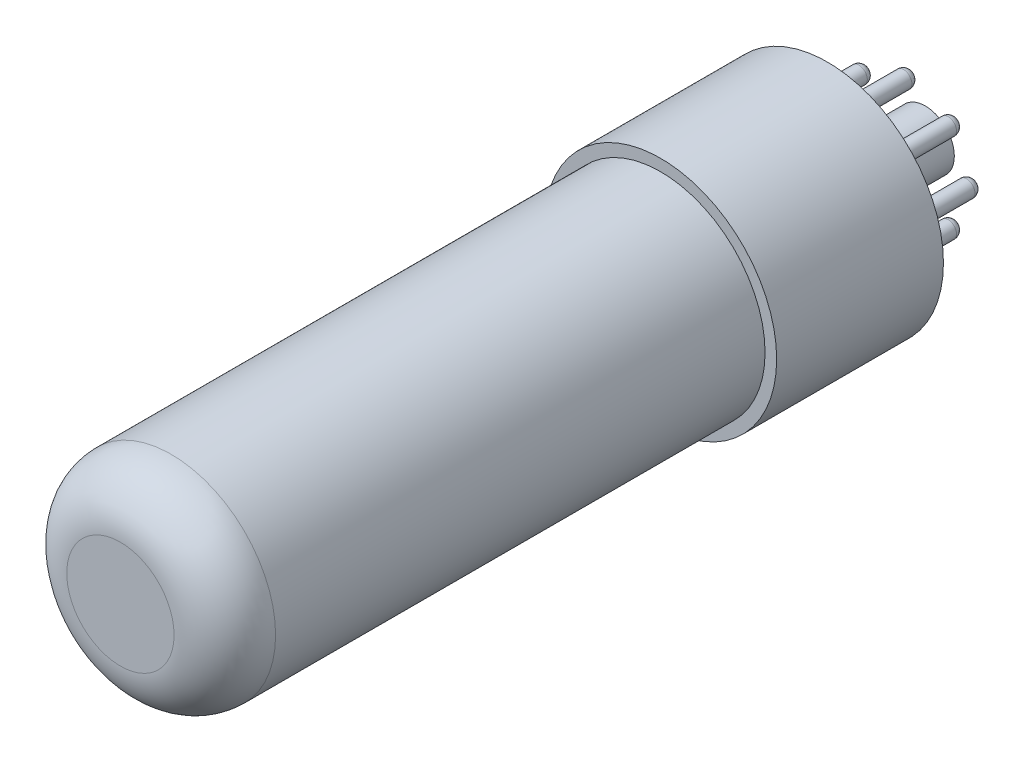
from build123d import *

# Parameters (mm, degrees)
SKETCH1_R                = 16
BASE_EXTRUDE_DEPTH       = 23
SKETCH2_R                = 14.4
SKETCH2_R_2              = 14.08
BOSS_EXTRUDE_THIN1_DEPTH = 69
SKETCH4_R                = 14.4
BOSS_EXTRUDE2_DEPTH      = 5.5
FILLET3_R                = 7
SKETCH5_R                = 4
BOSS_EXTRUDE3_DEPTH      = 13.5
SKETCH6_R                = 1.15
BOSS_EXTRUDE4_DEPTH      = 11.5
FILLET4_R                = 1
CIRPATTERN1_COUNT        = 8
FILLET4_OF_CIRPATTERN1_R = 1
BOSS_EXTRUDE5_DEPTH      = 0.3
EXTRUDE_THIN1_DEPTH      = 39
BOSS_EXTRUDE7_DEPTH      = 0.3
SKETCH15_W               = 2.2
SKETCH15_H               = 6
CUT_EXTRUDE14_DEPTH      = 18.3
SKETCH17_W               = 1.816140058
SKETCH17_H               = 1.29035869
CUT_EXTRUDE15_DEPTH      = 2.3
BOSS_EXTRUDE8_DEPTH      = 22.3
BOSS_EXTRUDE8_DEPTH_BACK = 19.3
BOSS_EXTRUDE9_DEPTH      = 37.3
BOSS_EXTRUDE9_DEPTH_BACK = 30.3
SKETCH18_3_R             = 0.5


# Read off the part's stored shape, not the designer's step: Extrude-Thin1
with BuildPart() as part:
    # Sketch1 → Base-Extrude (new body)
    with BuildSketch(Plane.XY):
        Circle(SKETCH1_R)
    extrude(amount=BASE_EXTRUDE_DEPTH)

    # Sketch2 → Boss-Extrude-Thin1 (add)
    with BuildSketch(Plane.XY.offset(23)):
        Circle(SKETCH2_R)
        Circle(SKETCH2_R_2, mode=Mode.SUBTRACT)
    extrude(amount=BOSS_EXTRUDE_THIN1_DEPTH)

    # Sketch4 → Boss-Extrude2 (add)
    with BuildSketch(Plane.XY.offset(92)):
        Circle(SKETCH4_R)
    extrude(amount=BOSS_EXTRUDE2_DEPTH)

    # Fillet3
    fillet3_edges = [part.edges().sort_by_distance(p)[0] for p in [
        (-14.4, 0, 97.5),
    ]]
    fillet(fillet3_edges, radius=FILLET3_R)

    # Sketch5 → Boss-Extrude3 (add)
    with BuildSketch(Plane(origin=(0, 0, 0), x_dir=(-1, 0, 0), z_dir=(0, 0, -1))):
        with Locations(Location((0, 0, 0), (0, 0, 180))):
            Circle(SKETCH5_R)
    extrude(amount=BOSS_EXTRUDE3_DEPTH)

    # Sketch6 → Boss-Extrude4 (add)
    with BuildSketch(Plane(origin=(0, 0, 0), x_dir=(-1, 0, 0), z_dir=(0, 0, -1))):
        with Locations(Location((8.7, 0, 0), (0, 0, 180))):
            Circle(SKETCH6_R)
    boss_extrude4 = extrude(amount=BOSS_EXTRUDE4_DEPTH)

    # Fillet4
    fillet4_edges = [part.edges().sort_by_distance(p)[0] for p in [
        (-9.85, 0, -11.5),
    ]]
    fillet(fillet4_edges, radius=FILLET4_R)

    # CirPattern1: Boss-Extrude4 ×8 about axis
    cirpattern1_axis = Axis((0, 0, 0), (0, 0, 1))
    for i in range(1, CIRPATTERN1_COUNT):
        add(boss_extrude4.rotate(cirpattern1_axis, i * 360 / CIRPATTERN1_COUNT))

    # Fillet4 of CirPattern1
    fillet4_of_cirpattern1_edges = [part.edges().sort_by_distance(p)[0] for p in [
        (-6.965001795, -6.965001795, -11.5),
        (0, -9.85, -11.5),
        (6.965001795, -6.965001795, -11.5),
        (9.85, 0, -11.5),
        (6.965001795, 6.965001795, -11.5),
        (0, 9.85, -11.5),
        (-6.965001795, 6.965001795, -11.5),
    ]]
    fillet(fillet4_of_cirpattern1_edges, radius=FILLET4_OF_CIRPATTERN1_R)



with BuildPart() as body_2:
    # Sketch7 → Boss-Extrude5 (new body)
    with BuildSketch(Plane.XY.offset(32)):
        Polygon((13.025686963, 4.711613485), (8.92476907, 10.593220452), (2.432466511, 13.636382554), (-4.711613485, 13.025686963), (-10.593220452, 8.92476907), (-13.636382554, 2.432466511), (-13.025686963, -4.711613485), (-8.92476907, -10.593220452), (-2.432466511, -13.636382554), (4.711613485, -13.025686963), (10.593220452, -8.92476907), (13.636382554, -2.432466511), align=None)
    extrude(amount=BOSS_EXTRUDE5_DEPTH)

    # Extrude-Thin1 outline → Extrude-Thin1 (add)
    with BuildSketch(Plane.XY.offset(32.3)):
        with BuildLine():
            ThreePointArc((8.807656387, 4.24917571), (8.655841302, 4.778875956), (8.246491686, 5.147743226))
            Line((8.246491686, 5.147743226), (5.750963675, 6.366489463))
            ThreePointArc((5.750963675, 6.366489463), (5.341614059, 6.735356733), (5.189798974, 7.265056979))
            Line((5.189798974, 7.265056979), (5.189798974, 7.807551147))
            ThreePointArc((5.189798974, 7.807551147), (4.896905756, 8.514657929), (4.189798974, 8.807551147))
            Line((4.189798974, 8.807551147), (0.318510646, 8.807551147))
            Line((0.318510646, 8.807551147), (0.318510646, 12.416922504))
            Line((0.318510646, 12.416922504), (-0.318510646, 12.416922504))
            Line((-0.318510646, 12.416922504), (-0.318510646, 8.807551147))
            Line((-0.318510646, 8.807551147), (-4.189798974, 8.807551147))
            ThreePointArc((-4.189798974, 8.807551147), (-4.896905756, 8.514657929), (-5.189798974, 7.807551147))
            Line((-5.189798974, 7.807551147), (-5.189798974, 7.265056979))
            ThreePointArc((-5.189798974, 7.265056979), (-5.341614059, 6.735356733), (-5.750963675, 6.366489463))
            Line((-5.750963675, 6.366489463), (-8.246491686, 5.147743226))
            ThreePointArc((-8.246491686, 5.147743226), (-8.655841302, 4.778875956), (-8.807656387, 4.24917571))
            Line((-8.807656387, 4.24917571), (-8.807656387, -4.24917571))
            ThreePointArc((-8.807656387, -4.24917571), (-8.655841302, -4.778875956), (-8.246491686, -5.147743226))
            Line((-8.246491686, -5.147743226), (-5.750963675, -6.366489463))
            ThreePointArc((-5.750963675, -6.366489463), (-5.341614059, -6.735356733), (-5.189798974, -7.265056979))
            Line((-5.189798974, -7.265056979), (-5.189798974, -7.807551147))
            ThreePointArc((-5.189798974, -7.807551147), (-4.896905756, -8.514657929), (-4.189798974, -8.807551147))
            Line((-4.189798974, -8.807551147), (-0.318510646, -8.807551147))
            Line((-0.318510646, -8.807551147), (-0.318510646, -12.416922504))
            Line((-0.318510646, -12.416922504), (0.318510646, -12.416922504))
            Line((0.318510646, -12.416922504), (0.318510646, -8.807551147))
            Line((0.318510646, -8.807551147), (4.189798974, -8.807551147))
            ThreePointArc((4.189798974, -8.807551147), (4.896905756, -8.514657929), (5.189798974, -7.807551147))
            Line((5.189798974, -7.807551147), (5.189798974, -7.265056979))
            ThreePointArc((5.189798974, -7.265056979), (5.341614059, -6.735356733), (5.750963675, -6.366489463))
            Line((5.750963675, -6.366489463), (8.246491686, -5.147743226))
            ThreePointArc((8.246491686, -5.147743226), (8.655841302, -4.778875956), (8.807656387, -4.24917571))
            Line((8.807656387, -4.24917571), (8.807656387, 4.24917571))
        make_face()
        with BuildLine():
            Line((5.312128377, 5.467921947), (7.807656387, 4.24917571))
            Line((7.807656387, 4.24917571), (7.807656387, -4.24917571))
            Line((7.807656387, -4.24917571), (5.312128377, -5.467921947))
            ThreePointArc((5.312128377, -5.467921947), (4.493429145, -6.205656487), (4.189798974, -7.265056979))
            Line((4.189798974, -7.265056979), (4.189798974, -7.807551147))
            Line((4.189798974, -7.807551147), (-4.189798974, -7.807551147))
            Line((-4.189798974, -7.807551147), (-4.189798974, -7.265056979))
            ThreePointArc((-4.189798974, -7.265056979), (-4.493429145, -6.205656487), (-5.312128377, -5.467921947))
            Line((-5.312128377, -5.467921947), (-7.807656387, -4.24917571))
            Line((-7.807656387, -4.24917571), (-7.807656387, 4.24917571))
            Line((-7.807656387, 4.24917571), (-5.312128377, 5.467921947))
            ThreePointArc((-5.312128377, 5.467921947), (-4.493429145, 6.205656487), (-4.189798974, 7.265056979))
            Line((-4.189798974, 7.265056979), (-4.189798974, 7.807551147))
            Line((-4.189798974, 7.807551147), (4.189798974, 7.807551147))
            Line((4.189798974, 7.807551147), (4.189798974, 7.265056979))
            ThreePointArc((4.189798974, 7.265056979), (4.493429145, 6.205656487), (5.312128377, 5.467921947))
        make_face(mode=Mode.SUBTRACT)
    extrude(amount=EXTRUDE_THIN1_DEPTH)

    # Sketch13 → Boss-Extrude7 (add)
    with BuildSketch(Plane.XY.offset(71.3)):
        Polygon((13.025686963, 4.711613485), (8.92476907, 10.593220452), (2.432466511, 13.636382554), (-4.711613485, 13.025686963), (-10.593220452, 8.92476907), (-13.636382554, 2.432466511), (-13.025686963, -4.711613485), (-8.92476907, -10.593220452), (-2.432466511, -13.636382554), (4.711613485, -13.025686963), (10.593220452, -8.92476907), (13.636382554, -2.432466511), align=None)
    extrude(amount=BOSS_EXTRUDE7_DEPTH)

    # Sketch15 → Cut-Extrude14 (cut)
    with BuildSketch(Plane.ZY.offset(8.807656387)):
        with Locations((59.3, 0)):
            Rectangle(SKETCH15_W, SKETCH15_H)
        with Locations((44.3, 0)):
            Rectangle(SKETCH15_W, SKETCH15_H)
    extrude(amount=-CUT_EXTRUDE14_DEPTH, mode=Mode.SUBTRACT)

    # Sketch17 → Cut-Extrude15 (cut)
    with BuildSketch(Plane(origin=(0.318510646, 0, 0), x_dir=(0, 0, -1), z_dir=(1, 0, 0))):
        with Locations((-68.950540345, 10.594366047)):
            Rectangle(SKETCH17_W, SKETCH17_H)
        with Locations((-60.950540345, 10.594366047)):
            Rectangle(SKETCH17_W, SKETCH17_H)
        with Locations((-52.950540345, 10.594366047)):
            Rectangle(SKETCH17_W, SKETCH17_H)
        with Locations((-44.950540345, 10.594366047)):
            Rectangle(SKETCH17_W, SKETCH17_H)
        with Locations((-36.950540345, 10.594366047)):
            Rectangle(SKETCH17_W, SKETCH17_H)
        with Locations((-36.950540345, -10.594366047)):
            Rectangle(SKETCH17_W, SKETCH17_H)
        with Locations((-44.950540345, -10.594366047)):
            Rectangle(SKETCH17_W, SKETCH17_H)
        with Locations((-52.950540345, -10.594366047)):
            Rectangle(SKETCH17_W, SKETCH17_H)
        with Locations((-60.950540345, -10.594366047)):
            Rectangle(SKETCH17_W, SKETCH17_H)
        with Locations((-68.950540345, -10.594366047)):
            Rectangle(SKETCH17_W, SKETCH17_H)
    extrude(amount=-CUT_EXTRUDE15_DEPTH, mode=Mode.SUBTRACT)


with BuildPart() as body_3:
    # Sketch18 → Boss-Extrude8 (new, two sides: drawn at the far end of the back side and taken through both)
    with BuildSketch(Plane.XY.offset(51.65).offset(-BOSS_EXTRUDE8_DEPTH_BACK)):
        with BuildLine():
            Line((-1.5, 1.25), (1.5, 1.25))
            ThreePointArc((1.5, 1.25), (2.75, 0), (1.5, -1.25))
            Line((1.5, -1.25), (-1.5, -1.25))
            ThreePointArc((-1.5, -1.25), (-2.75, 0), (-1.5, 1.25))
        make_face()
    extrude(amount=BOSS_EXTRUDE8_DEPTH + BOSS_EXTRUDE8_DEPTH_BACK)


with BuildPart() as part_1:
    add(part.part)

    add(body_2.part)  # Boss-Extrude9 merges body 2
    # Sketch18<3> → Boss-Extrude9 (add, two sides: drawn at the far end of the back side and taken through both)
    with BuildSketch(Plane.XY.offset(51.65).offset(-BOSS_EXTRUDE9_DEPTH_BACK)):
        with Locations((0, 5)):
            Circle(SKETCH18_3_R)
        with Locations((0, 10)):
            Circle(SKETCH18_3_R)
        with Locations((0, -10)):
            Circle(SKETCH18_3_R)
        with Locations((0, -5)):
            Circle(SKETCH18_3_R)
    extrude(amount=BOSS_EXTRUDE9_DEPTH + BOSS_EXTRUDE9_DEPTH_BACK)


solid = Compound([body_3.part, part_1.part])
